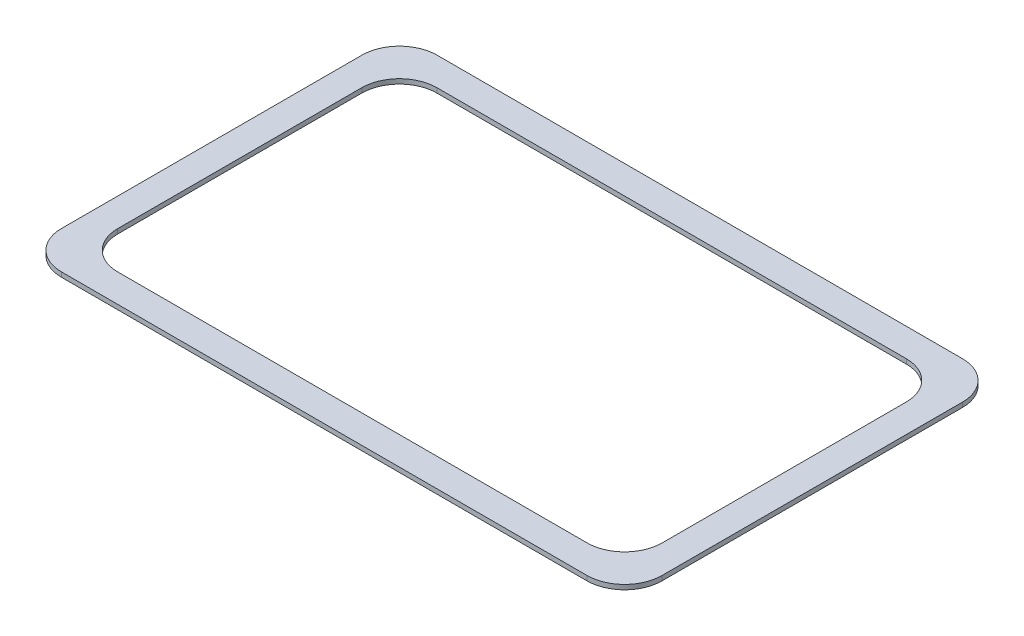
from build123d import *

# Parameters (mm, degrees)
MAINBODY_DEPTH = 1.5875


with BuildPart() as part:
    # Sketch2 → MainBody (new body)
    with BuildSketch(Plane(origin=(0, -26.878556156, 0), x_dir=(-1, 0, 0), z_dir=(0, -1, 0))):
        with BuildLine():
            Line((-138.863402872, 98.236449797), (38.936589178, 98.289621238))
            ThreePointArc((38.936589178, 98.289621238), (47.917957294, 94.572563089), (51.64038657, 85.593419766))
            Line((51.64038657, 85.593419766), (51.670770251, -16.006575691))
            ThreePointArc((51.670770251, -16.006575691), (47.953712101, -24.987943807), (38.974568779, -28.710373083))
            Line((38.974568779, -28.710373083), (-138.825423271, -28.763544524))
            ThreePointArc((-138.825423271, -28.763544524), (-147.806791387, -25.046486374), (-151.529220663, -16.067343052))
            Line((-151.529220663, -16.067343052), (-151.559604344, 85.532652405))
            ThreePointArc((-151.559604344, 85.532652405), (-147.842546194, 94.514020521), (-138.863402872, 98.236449797))
        make_face()
        with BuildLine():
            Line((-129.319412503, -19.211958803), (29.43057841, -19.211958803))
            ThreePointArc((29.43057841, -19.211958803), (38.410834531, -15.492214924), (42.13057841, -6.511958803))
            Line((42.13057841, -6.511958803), (42.13057841, 76.038035518))
            ThreePointArc((42.13057841, 76.038035518), (38.410834531, 85.018291639), (29.43057841, 88.738035518))
            Line((29.43057841, 88.738035518), (-129.319412503, 88.738035518))
            ThreePointArc((-129.319412503, 88.738035518), (-138.299668624, 85.018291639), (-142.019412503, 76.038035518))
            Line((-142.019412503, 76.038035518), (-142.019412503, -6.511958803))
            ThreePointArc((-142.019412503, -6.511958803), (-138.299668624, -15.492214924), (-129.319412503, -19.211958803))
        make_face(mode=Mode.SUBTRACT)
    extrude(amount=MAINBODY_DEPTH)


solid = part.part
